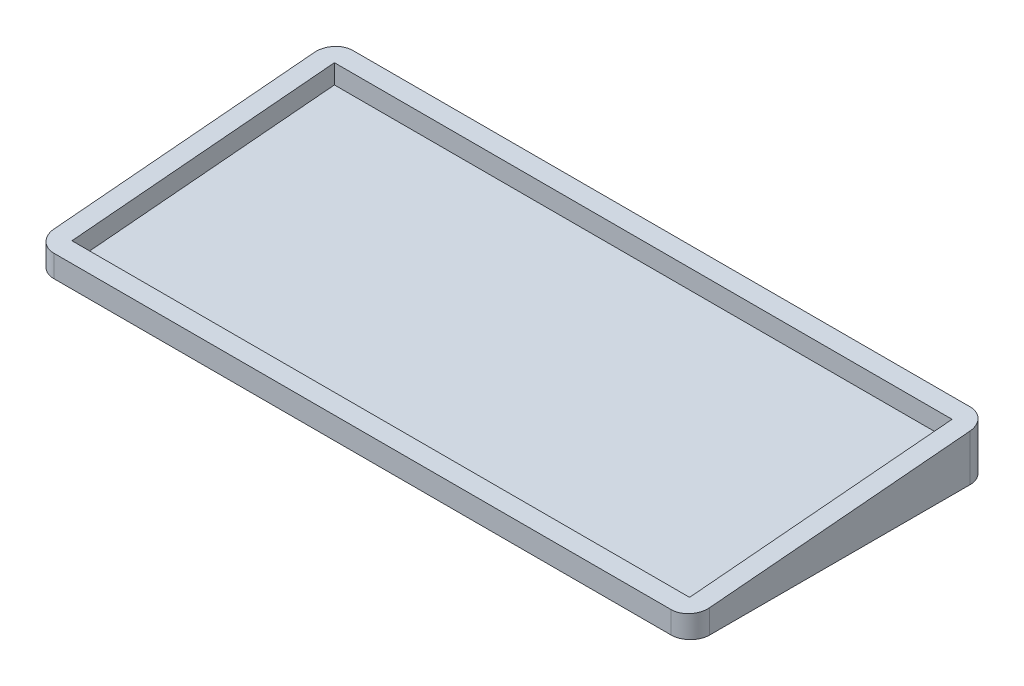
from build123d import *

# Parameters (mm, degrees)
SKETCH1_W               = 340
SKETCH1_H               = 155
BOSS_EXTRUDE1_DEPTH     = 25
CUT_EXTRUDE1_DEPTH      = 189.497347461
CUT_EXTRUDE1_DEPTH_BACK = 189.497347461
FILLET1_R               = 10
SKETCH3_W               = 250
SKETCH3_H               = 100
CUT_EXTRUDE2_DEPTH      = 3
CUT_EXTRUDE3_REACH      = 200.497
SKETCH4_W               = 320.259398984
SKETCH4_H               = 136.101073336


with BuildPart() as part:
    # Sketch1 → Boss-Extrude1 (new body)
    with BuildSketch(Plane(origin=(0, 0, 0), x_dir=(1, 0, 0), z_dir=(0, 1, 0))):
        Rectangle(SKETCH1_W, SKETCH1_H)
    extrude(amount=BOSS_EXTRUDE1_DEPTH)

    # Sketch2 → Cut-Extrude1 (cut, two sides: drawn at the far end of the back side and taken through both)
    with BuildSketch(Plane(origin=(0, 0, 0), x_dir=(0, 0, -1), z_dir=(1, 0, 0)).offset(-CUT_EXTRUDE1_DEPTH_BACK)):
        Polygon((-77.5, 11.439257153), (77.5, 25), (-77.5, 25), align=None)
    extrude(amount=CUT_EXTRUDE1_DEPTH + CUT_EXTRUDE1_DEPTH_BACK, mode=Mode.SUBTRACT)

    # Fillet1
    fillet1_edges = [part.edges().sort_by_distance(p)[0] for p in [
        (170, 12.5, -77.5),
        (-170, 5.719628577, 77.5),
        (-170, 12.5, -77.5),
        (170, 5.719628577, 77.5),
    ]]
    fillet(fillet1_edges, radius=FILLET1_R)

    # Sketch3 → Cut-Extrude2 (cut)
    with BuildSketch(Plane.XZ):
        with Locations((0, -20)):
            Rectangle(SKETCH3_W, SKETCH3_H)
    extrude(amount=-CUT_EXTRUDE2_DEPTH, mode=Mode.SUBTRACT)

    # Cut-Extrude3: from a plane face, 200.497 long prism both ways, kept between that surface and its translate by the depth
    cut_extrude3_start = Plane(origin=(-170, 11.439257153, 77.5), z_dir=(0, -0.9961946980917461, -0.08715574274765171)) * Box(803.988, 803.988, 401.994, align=(Align.CENTER, Align.CENTER, Align.MIN), mode=Mode.PRIVATE)
    cut_extrude3_end = Plane(origin=(-170, 1.439257153, 77.5), z_dir=(0, -0.9961946980917461, -0.08715574274765171)) * Box(803.988, 803.988, 401.994, align=(Align.CENTER, Align.CENTER, Align.MIN), mode=Mode.PRIVATE)
    # Sketch4 → Cut-Extrude3 (cut, from a surface)
    with BuildSketch(Plane(origin=(0, 0, 0), x_dir=(1, 0, 0), z_dir=(0, 1, 0)), mode=Mode.PRIVATE) as cut_extrude3_sk1:
        Rectangle(SKETCH4_W, SKETCH4_H)
    cut_extrude3_tool1 = extrude(cut_extrude3_sk1.sketch, amount=CUT_EXTRUDE3_REACH, both=True, mode=Mode.PRIVATE)
    add(((cut_extrude3_tool1 & cut_extrude3_start) - cut_extrude3_end).solids().sort_by_distance((0, 18.219629, 0))[0], mode=Mode.SUBTRACT)


solid = part.part
